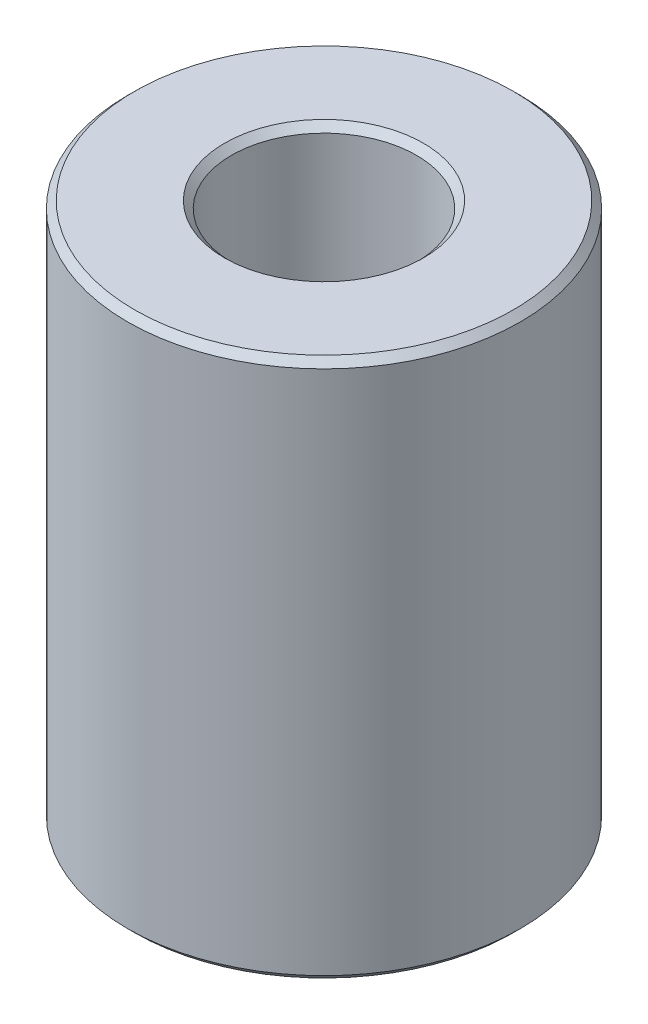
from build123d import *

# Parameters (mm, degrees)
SKETCH1_R           = 55
BOSS_EXTRUDE1_DEPTH = 151.114426705
SKETCH2_R           = 25.911089028
CUT_EXTRUDE1_DEPTH  = 170.957553402
CHAMFER1_SIZE       = 1.952161579


with BuildPart() as part:
    # Sketch1 → Boss-Extrude1 (new body)
    with BuildSketch(Plane(origin=(0, 0, 0), x_dir=(1, 0, 0), z_dir=(0, 1, 0))):
        Circle(SKETCH1_R)
    extrude(amount=BOSS_EXTRUDE1_DEPTH)

    # Sketch2 → Cut-Extrude1 (cut, through all)
    with BuildSketch(Plane(origin=(0, 0, 0), x_dir=(1, 0, 0), z_dir=(0, 1, 0))):
        Circle(SKETCH2_R)
    extrude(amount=CUT_EXTRUDE1_DEPTH, mode=Mode.SUBTRACT)

    # Chamfer1
    chamfer1_edges = [part.edges().sort_by_distance(p)[0] for p in [
        (-25.911089028, 151.114426705, 0),
        (-25.911089028, 0, 0),
        (-55, 0, 0),
        (-55, 151.114426705, 0),
    ]]
    chamfer(chamfer1_edges, length=CHAMFER1_SIZE)


solid = part.part
